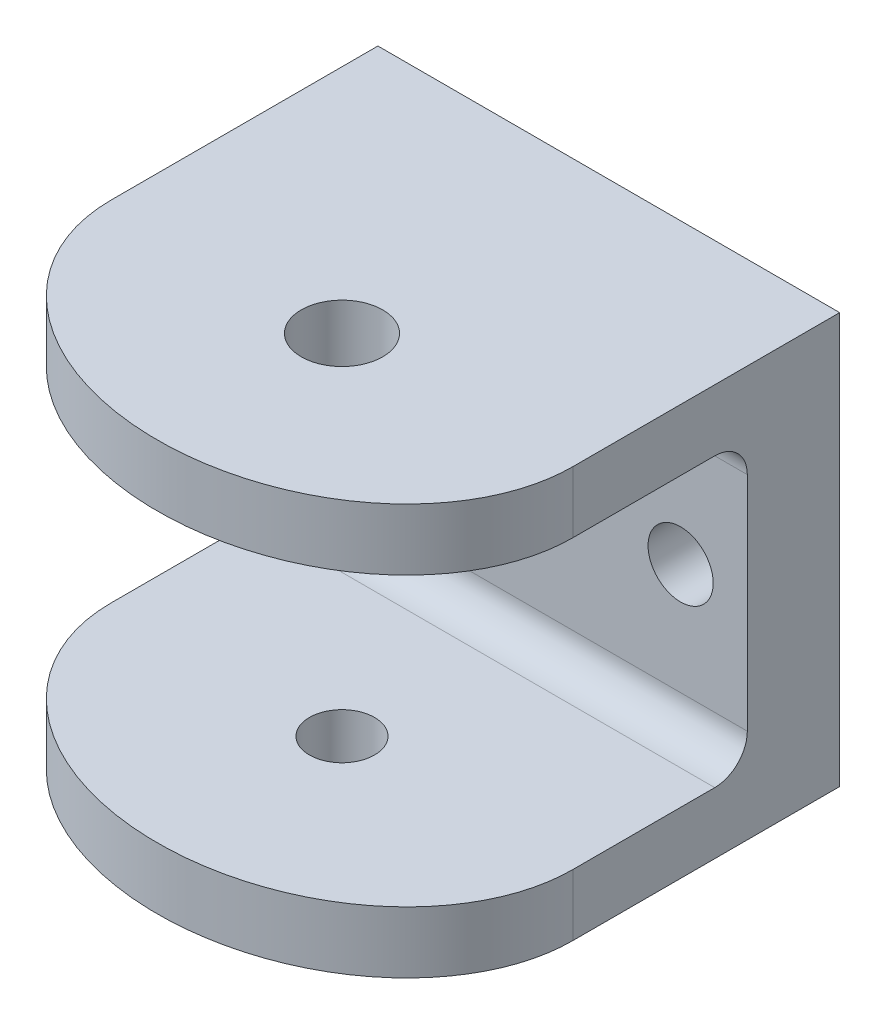
from build123d import *

# Parameters (mm, degrees)
SKETCH1_W           = 45
SKETCH1_H           = 40
SKETCH1_R           = 3.175
BOSS_EXTRUDE1_DEPTH = 9
SKETCH2_W           = 45
SKETCH2_H           = 6
BOSS_EXTRUDE2_DEPTH = 35
FILLET1_R           = 3.175
SKETCH3_R           = 3.175
CUT_EXTRUDE1_DEPTH  = 64.578691399
SKETCH5_R           = 3.96875
CUT_EXTRUDE2_DEPTH  = 10


with BuildPart() as part:
    # Sketch1 → Boss-Extrude1 (new body)
    with BuildSketch(Plane.XY):
        Rectangle(SKETCH1_W, SKETCH1_H)
        with Locations((16, 0)):
            Circle(SKETCH1_R, mode=Mode.SUBTRACT)
        with Locations((-16, 0)):
            Circle(SKETCH1_R, mode=Mode.SUBTRACT)
    extrude(amount=BOSS_EXTRUDE1_DEPTH)

    # Sketch2 → Boss-Extrude2 (add)
    with BuildSketch(Plane.XY.offset(9)):
        with Locations((0, 17)):
            Rectangle(SKETCH2_W, SKETCH2_H)
        with Locations((0, -17)):
            Rectangle(SKETCH2_W, SKETCH2_H)
    extrude(amount=BOSS_EXTRUDE2_DEPTH)

    # Fillet1
    fillet1_edges = [part.edges().sort_by_distance(p)[0] for p in [
        (0, 14, 9),
        (0, -14, 9),
    ]]
    fillet(fillet1_edges, radius=FILLET1_R)

    # Sketch3 → Cut-Extrude1 (cut, through all)
    with BuildSketch(Plane(origin=(0, 20, 0), x_dir=(1, 0, 0), z_dir=(0, 1, 0))):
        with BuildLine():
            Line((9.08e-07, -44), (22.5, -44))
            Line((22.5, -44), (22.5, -26))
            add(Edge.make_bspline(
                [(9.08e-07, -44), (7.181949883, -43.99999957), (13.035725314, -40.671220242), (22.4999996, -35.289312281), (22.5, -26)],
                knots=[1.530551828, 1.530551828, 1.530551828, 2.188746363, 2.188746363, 3.155795213, 3.155795213, 3.155795213], degree=2, weights=[0.772303258, 0.837192571, 1, 0.760796044, 0.732965973]))
        make_face()
        with BuildLine():
            Line((-22.5, -44), (9.08e-07, -44))
            add(Edge.make_bspline(
                [(-22.5, -26.000001723), (-22.499998622, -44.000001347), (9.08e-07, -44)],
                knots=[0, 0, 0, 1.530551828, 1.530551828, 1.530551828], degree=2, weights=[1, 0.621411005, 0.772303258]))
            Line((-22.5, -26.000001723), (-22.5, -44))
        make_face()
        with Locations((0, -26)):
            Circle(SKETCH3_R)
    extrude(amount=-CUT_EXTRUDE1_DEPTH, mode=Mode.SUBTRACT)

    # Sketch5 → Cut-Extrude2 (cut)
    with BuildSketch(Plane(origin=(0, 20, 0), x_dir=(1, 0, 0), z_dir=(0, 1, 0))):
        with Locations((0, -26)):
            Circle(SKETCH5_R)
    extrude(amount=-CUT_EXTRUDE2_DEPTH, mode=Mode.SUBTRACT)


solid = part.part
